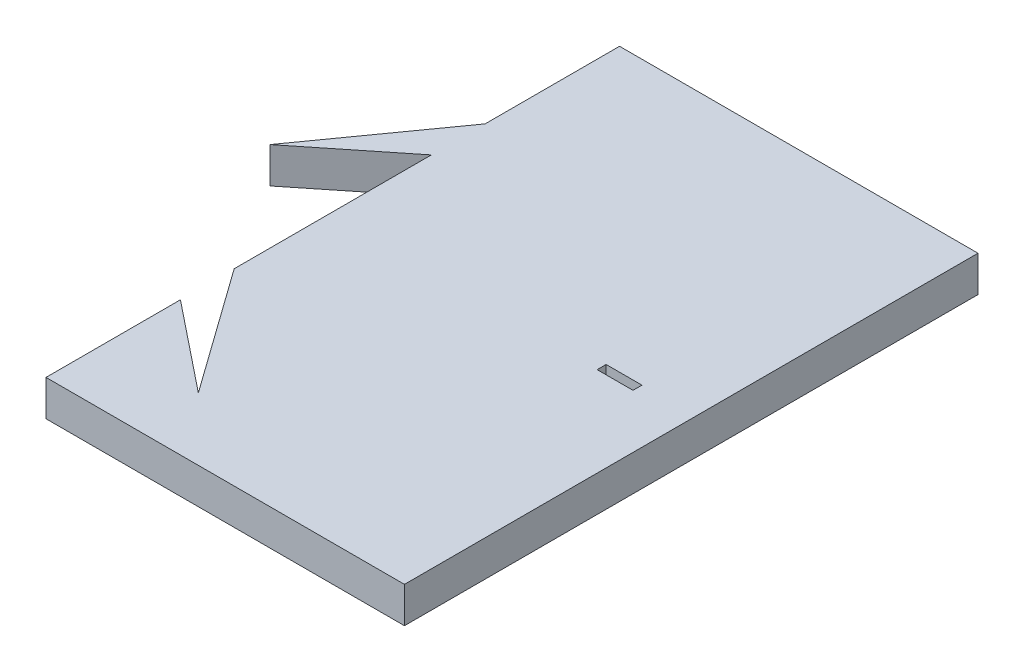
from build123d import *

# Parameters (mm, degrees)
BOSS_EXTRUDE1_DEPTH = 20
SKETCH2_W           = 20
SKETCH2_H           = 5
CUT_EXTRUDE1_DEPTH  = 378.888872554


with BuildPart() as part:
    # Sketch1 → Boss-Extrude1 (new body)
    with BuildSketch(Plane(origin=(0, 0, 0), x_dir=(1, 0, 0), z_dir=(0, 1, 0))):
        Polygon((0, 75), (50, 35), (0, 105), (0, 215), (-50, 175), (0, 245), (0, 320), (200, 320), (200, 0), (0, 0), align=None)
    extrude(amount=BOSS_EXTRUDE1_DEPTH)

    # Sketch2 → Cut-Extrude1 (cut, through all)
    with BuildSketch(Plane.XZ):
        with Locations((160, -160)):
            Rectangle(SKETCH2_W, SKETCH2_H)
    extrude(amount=-CUT_EXTRUDE1_DEPTH, mode=Mode.SUBTRACT)


solid = part.part
